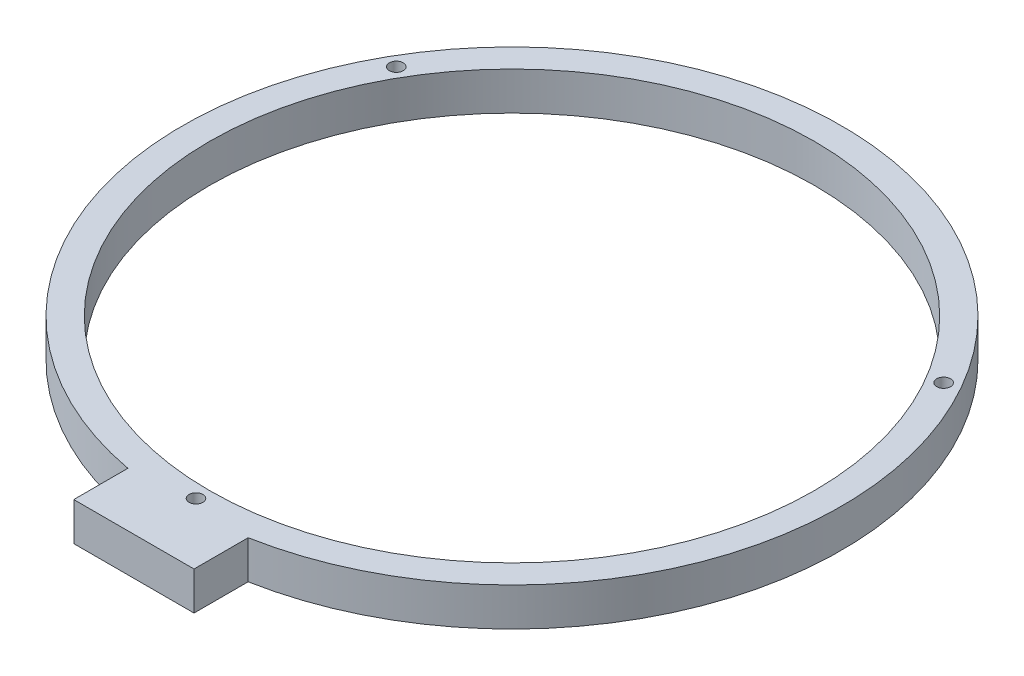
from build123d import *

# Parameters (mm, degrees)
SKETCH1_R           = 50.3
BOSS_EXTRUDE1_DEPTH = 6.35
CUT_EXTRUDE1_REACH  = 85.65
SKETCH2_R           = 1.15
CIRPATTERN1_COUNT   = 3


with BuildPart() as part:
    # Sketch1 → Boss-Extrude1 (new body)
    with BuildSketch(Plane(origin=(0, 0, 0), x_dir=(1, 0, 0), z_dir=(0, 1, 0))):
        with BuildLine():
            Line((-10, -53.87986637), (-10, -62.87986637))
            Line((-10, -62.87986637), (10, -62.87986637))
            Line((10, -62.87986637), (10, -53.87986637))
            ThreePointArc((10, -53.87986637), (0, 54.8), (-10, -53.87986637))
        make_face()
        Circle(SKETCH1_R, mode=Mode.SUBTRACT)
    extrude(amount=BOSS_EXTRUDE1_DEPTH)

    # Sketch2 → Cut-Extrude1 (cut, up to next)
    with BuildSketch(Plane(origin=(0, 6.35, 0), x_dir=(1, 0, 0), z_dir=(0, 1, 0)), mode=Mode.PRIVATE) as cut_extrude1_sk1:
        with Locations((0, -52.55)):
            Circle(SKETCH2_R)
    cut_extrude1_tool1 = extrude(cut_extrude1_sk1.sketch, amount=-CUT_EXTRUDE1_REACH, mode=Mode.PRIVATE) & part.part
    cut_extrude1 = cut_extrude1_tool1.solids().sort_by_distance((0, 6.35, 52.55))[0]
    add(cut_extrude1, mode=Mode.SUBTRACT)

    # CirPattern1: Cut-Extrude1 ×3 about axis
    cirpattern1_axis = Axis((0, 6.35, 0), (0, 1, 0))
    for i in range(1, CIRPATTERN1_COUNT):
        add(cut_extrude1.rotate(cirpattern1_axis, i * 360 / CIRPATTERN1_COUNT), mode=Mode.SUBTRACT)


solid = part.part
